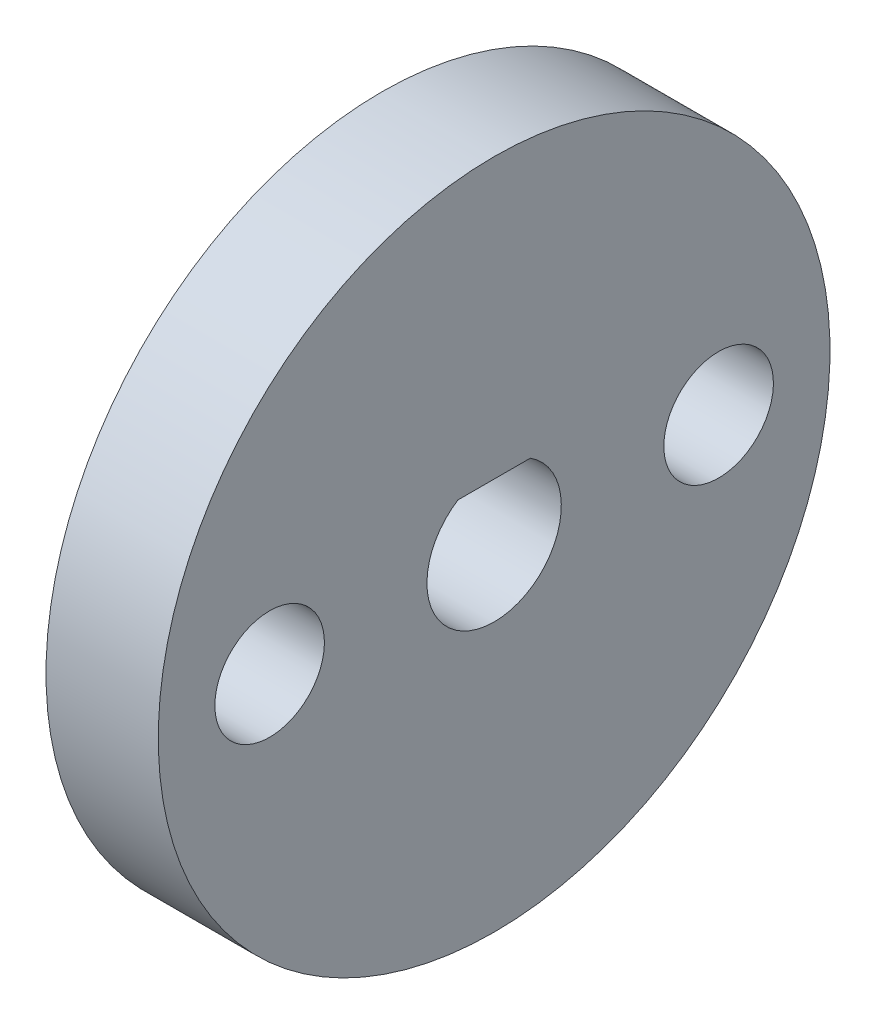
from build123d import *

# Parameters (mm, degrees)
SKETCH1_R           = 9.5
SKETCH1_R_2         = 1.5494
BOSS_EXTRUDE1_DEPTH = 3.175


# Read off the part's stored shape, not the designer's step: Imported1
with BuildPart() as part:
    # Sketch1 → Boss-Extrude1 (new body)
    with BuildSketch(Plane(origin=(2.25, 0, 0), x_dir=(0, 0, -1), z_dir=(1, 0, 0))):
        with Locations(Location((0, 0, 0), (0, 0, 90))):
            Circle(SKETCH1_R)
        with Locations(Location((-6.35, 0, 0), (0, 0, 90))):
            Circle(SKETCH1_R_2, mode=Mode.SUBTRACT)
        with Locations(Location((6.35, 0, 0), (0, 0, 90))):
            Circle(SKETCH1_R_2, mode=Mode.SUBTRACT)
        with BuildLine():
            Line((-1.024695077, 1.6), (1.024695077, 1.6))
            ThreePointArc((1.024695077, 1.6), (0, -1.9), (-1.024695077, 1.6))
        make_face(mode=Mode.SUBTRACT)
    extrude(amount=BOSS_EXTRUDE1_DEPTH)


solid = part.part
